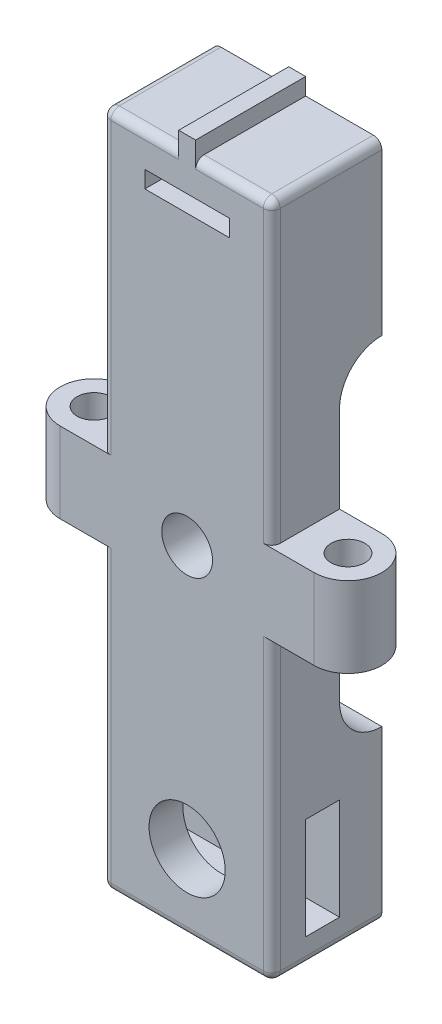
from build123d import *

# Parameters (mm, degrees)
BOSS_EXTRUDE1_DEPTH      = 10
SKETCH7_R                = 2
BOSS_EXTRUDE4_DEPTH      = 4.75
SKETCH8_R                = 3
CUT_EXTRUDE1_DEPTH       = 8
FILLET1_R                = 1
M8_CLEARANCE_HOLE1_D     = 9
FILLET2_R                = 5
SKETCH15_W               = 4
SKETCH15_H               = 12
CUT_EXTRUDE2_DEPTH       = 20
SKETCH16_W               = 10
SKETCH16_H               = 2
CUT_EXTRUDE3_DEPTH       = 47.151923037
FILLET3_R                = 5
BOSS_EXTRUDE5_DEPTH      = 2
BOSS_EXTRUDE5_DEPTH_BACK = 2
SKETCH17_W               = 2
SKETCH17_H               = 13


with BuildPart() as part:
    # Sketch1 → Boss-Extrude1 (new, symmetric)
    with BuildSketch(Plane(origin=(0, 0, 0), x_dir=(0, 0, -1), z_dir=(1, 0, 0))):
        Polygon((0, -20), (0, 20), (5, 20), (5, 40), (-8, 40), (-8, 20), (-8, -20), (-8, -40), (5, -40), (5, -20), align=None)
    extrude(amount=BOSS_EXTRUDE1_DEPTH, both=True)

    # Sketch7 → Boss-Extrude4 (add, symmetric)
    # profile 1 of 2: a face of its own
    with BuildSketch(Plane(origin=(0, 0, 0), x_dir=(1, 0, 0), z_dir=(0, 1, 0))):
        with BuildLine():
            Line((-15, 0), (-10, 0))
            Line((-10, 0), (-10, -8))
            Line((-10, -8), (-15, -8))
            ThreePointArc((-15, -8), (-19, -4), (-15, 0))
        make_face()
        with Locations(Location((-15, -4, 0), (0, 0, 270))):
            Circle(SKETCH7_R, mode=Mode.SUBTRACT)
    # profile 2 of 2: a face of its own
    with BuildSketch(Plane(origin=(0, 0, 0), x_dir=(1, 0, 0), z_dir=(0, 1, 0))):
        with BuildLine():
            Line((15, -8), (10, -8))
            Line((10, -8), (10, 0))
            Line((10, 0), (15, 0))
            ThreePointArc((15, 0), (19, -4), (15, -8))
        make_face()
        with Locations(Location((15, -4, 0), (0, 0, 90))):
            Circle(SKETCH7_R, mode=Mode.SUBTRACT)
    extrude(amount=BOSS_EXTRUDE4_DEPTH, both=True)

    # Sketch8 → Cut-Extrude1 (cut)
    with BuildSketch(Plane(origin=(0, 0, 0), x_dir=(-1, 0, 0), z_dir=(0, 0, -1))):
        Circle(SKETCH8_R)
    extrude(amount=-CUT_EXTRUDE1_DEPTH, mode=Mode.SUBTRACT)

    # Fillet1
    fillet1_edges = [part.edges().sort_by_distance(p)[0] for p in [
        (-10, -40, 1.5),
        (10, -40, 1.5),
        (-10, 40, 1.5),
        (10, 40, 1.5),
        (0, -40, 8),
        (-10, -22.375, 8),
        (10, -22.375, 8),
        (10, 22.375, 8),
        (0, 40, 8),
        (-10, 22.375, 8),
    ]]
    fillet(fillet1_edges, radius=FILLET1_R)

    # M8 Clearance Hole1 (through all)
    with Locations(Plane(origin=(0, -31, -5), x_dir=(-1, 0, 0), z_dir=(0, 0, -1))):
        with Locations((0, 0)):
            Hole(M8_CLEARANCE_HOLE1_D / 2)

    # Fillet2
    fillet2_edges = [part.edges().sort_by_distance(p)[0] for p in [
        (0, 20, 0),
        (0, -20, 0),
    ]]
    fillet(fillet2_edges, radius=FILLET2_R - 0.0001)  # a hair under: the kernel refuses the full size

    # Sketch15 → Cut-Extrude2 (cut)
    with BuildSketch(Plane.ZY.offset(10)):
        with Locations((2, -31)):
            Rectangle(SKETCH15_W, SKETCH15_H)
    extrude(amount=-CUT_EXTRUDE2_DEPTH, mode=Mode.SUBTRACT)

    # Sketch16 → Cut-Extrude3 (cut, through all)
    with BuildSketch(Plane.XY.offset(8)):
        with Locations((0, 35)):
            Rectangle(SKETCH16_W, SKETCH16_H)
    extrude(amount=-CUT_EXTRUDE3_DEPTH, mode=Mode.SUBTRACT)

    # Fillet3
    fillet3_edges = [part.edges().sort_by_distance(p)[0] for p in [
        (0, 34, -5),
    ]]
    fillet(fillet3_edges, radius=FILLET3_R)

    # Sketch17 → Boss-Extrude5 (add, two sides: drawn at the far end of the back side and taken through both)
    with BuildSketch(Plane(origin=(0, 40, 0), x_dir=(1, 0, 0), z_dir=(0, 1, 0)).offset(-BOSS_EXTRUDE5_DEPTH_BACK)):
        with Locations((0, -1.5)):
            Rectangle(SKETCH17_W, SKETCH17_H)
    extrude(amount=BOSS_EXTRUDE5_DEPTH + BOSS_EXTRUDE5_DEPTH_BACK)


solid = part.part
